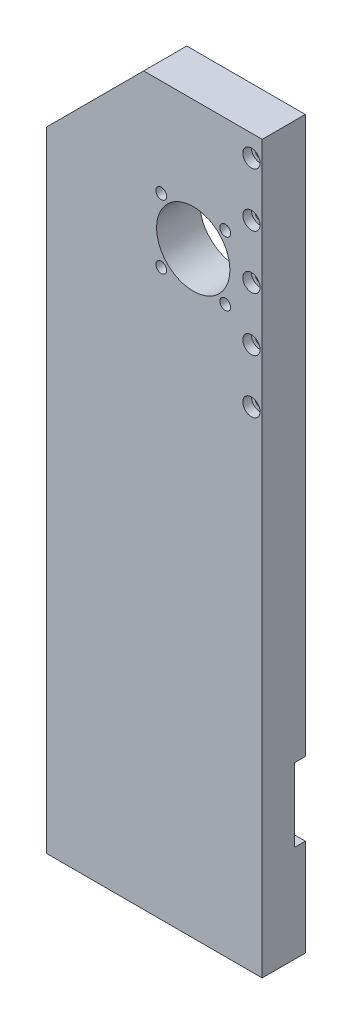
from build123d import *

# Parameters (mm, degrees)
SKETCH1_W                      = 100
SKETCH1_H                      = 337
SKETCH1_R                      = 17
SKETCH1_R_2                    = 2.5
BOSS_EXTRUDE1_DEPTH            = 20
CHAMFER1_SIZE                  = 45
SKETCH2_W                      = 100
SKETCH2_H                      = 34
CUT_EXTRUDE1_DEPTH             = 5
CBORE_FOR_M4_SHCS1_D           = 4.5
CBORE_FOR_M4_SHCS1_CBORE_D     = 8
CBORE_FOR_M4_SHCS1_CBORE_DEPTH = 4


with BuildPart() as part:
    # Sketch1 → Boss-Extrude1 (new body)
    with BuildSketch(Plane.XY):
        with Locations((47.704546062, 452.000370419)):
            Rectangle(SKETCH1_W, SKETCH1_H)
        with Locations((65.704546062, 560.500370419)):
            Circle(SKETCH1_R, mode=Mode.SUBTRACT)
        with Locations((80.553788467, 575.349612824)):
            Circle(SKETCH1_R_2, mode=Mode.SUBTRACT)
        with Locations((80.553788467, 545.651128014)):
            Circle(SKETCH1_R_2, mode=Mode.SUBTRACT)
        with Locations((50.855303657, 545.651128014)):
            Circle(SKETCH1_R_2, mode=Mode.SUBTRACT)
        with Locations((50.855303657, 575.349612824)):
            Circle(SKETCH1_R_2, mode=Mode.SUBTRACT)
    extrude(amount=BOSS_EXTRUDE1_DEPTH)

    # Chamfer1
    chamfer1_edges = [part.edges().sort_by_distance(p)[0] for p in [
        (-2.295453938, 620.500370419, 10),
    ]]
    chamfer(chamfer1_edges, length=CHAMFER1_SIZE)

    # Sketch2 → Cut-Extrude1 (cut)
    with BuildSketch(Plane.XY):
        with Locations((47.704546062, 345.500370419)):
            Rectangle(SKETCH2_W, SKETCH2_H)
    extrude(amount=CUT_EXTRUDE1_DEPTH, mode=Mode.SUBTRACT)

    # CBORE for M4 SHCS1 (through all)
    with Locations(Plane.XY.offset(20)):
        with Locations((92.704546062, 610.500370419), (92.704546062, 585.500370419), (92.704546062, 560.500370419), (92.704546062, 535.500370419), (92.704546062, 510.500370419)):
            CounterBoreHole(CBORE_FOR_M4_SHCS1_D / 2, CBORE_FOR_M4_SHCS1_CBORE_D / 2, CBORE_FOR_M4_SHCS1_CBORE_DEPTH)


solid = part.part
